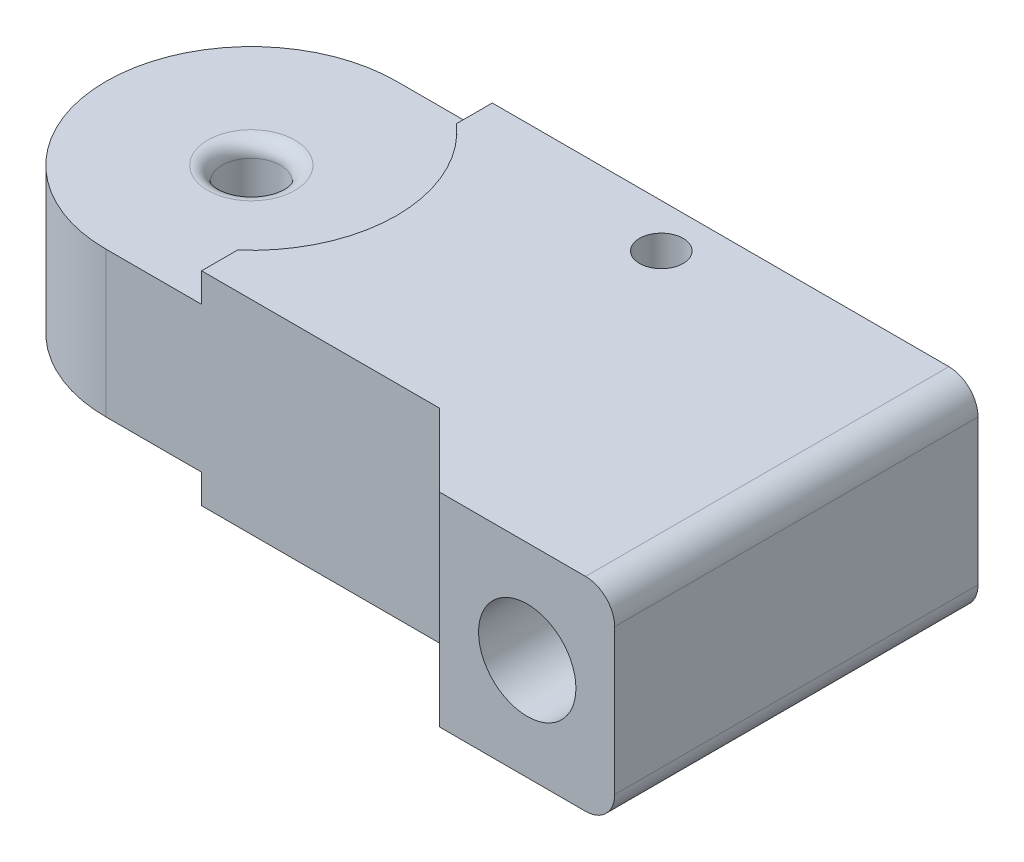
from build123d import *

# Parameters (mm, degrees)
SKETCH1_W           = 50
SKETCH1_H           = 20
BOSS_EXTRUDE1_DEPTH = 10
FILLET1_R           = 10
SKETCH2_R           = 2
CUT_EXTRUDE1_DEPTH  = 10
SKETCH4_R           = 3.35
CUT_EXTRUDE2_DEPTH  = 40
BOSS_EXTRUDE3_DEPTH = 2
SKETCH7_R           = 1.5
CUT_EXTRUDE3_DEPTH  = 20
FILLET3_R           = 2
FILLET4_R           = 1
SKETCH8_R           = 3.35
BOSS_EXTRUDE4_DEPTH = 5
CHAMFER1_SIZE       = 5


with BuildPart() as part:
    # Sketch1 → Boss-Extrude1 (new body)
    with BuildSketch(Plane(origin=(0, 0, 0), x_dir=(1, 0, 0), z_dir=(0, 1, 0))):
        Rectangle(SKETCH1_W, SKETCH1_H)
    extrude(amount=BOSS_EXTRUDE1_DEPTH)

    # Fillet1
    fillet1_edges = [part.edges().sort_by_distance(p)[0] for p in [
        (-25, 5, 10),
        (-25, 5, -10),
    ]]
    fillet(fillet1_edges, radius=FILLET1_R - 0.0001)  # a hair under: the kernel refuses the full size

    # Sketch2 → Cut-Extrude1 (cut)
    with BuildSketch(Plane(origin=(0, 10, 0), x_dir=(1, 0, 0), z_dir=(0, 1, 0))):
        with Locations(Location((-15, 0, 0), (0, 0, 270))):
            Circle(SKETCH2_R)
    extrude(amount=-CUT_EXTRUDE1_DEPTH, mode=Mode.SUBTRACT)

    # Sketch4 → Cut-Extrude2 (cut)
    with BuildSketch(Plane(origin=(0, 0, -10), x_dir=(-1, 0, 0), z_dir=(0, 0, -1))):
        with Locations((-18.984247751, 5)):
            Circle(SKETCH4_R)
    extrude(amount=-CUT_EXTRUDE2_DEPTH, mode=Mode.SUBTRACT)

    # Sketch6 → Boss-Extrude3 (add)
    with BuildSketch(Plane(origin=(0, 10, 0), x_dir=(1, 0, 0), z_dir=(0, 1, 0))):
        with BuildLine():
            Line((-8.420233762, 10), (-8.420233762, 7.53038354))
            ThreePointArc((-8.420233762, 7.53038354), (-5, 0), (-8.420233762, -7.53038354))
            Line((-8.420233762, -7.53038354), (-8.420233762, -10))
            Line((-8.420233762, -10), (25, -10))
            Line((25, -10), (25, 10))
            Line((25, 10), (-8.420233762, 10))
        make_face()
    boss_extrude3 = extrude(amount=BOSS_EXTRUDE3_DEPTH)

    # Sketch7 → Cut-Extrude3 (cut)
    with BuildSketch(Plane(origin=(0, 12, 0), x_dir=(1, 0, 0), z_dir=(0, 1, 0))):
        with Locations(Location((6.210160934, 7, 0), (0, 0, 270))):
            Circle(SKETCH7_R)
    cut_extrude3 = extrude(amount=-CUT_EXTRUDE3_DEPTH, mode=Mode.SUBTRACT)

    # Mirror3: Boss-Extrude3, Cut-Extrude3 across plane
    add(boss_extrude3.mirror(Plane(origin=(0, 5, 0), x_dir=(0, 0, 1), z_dir=(0, -1, 0))))
    add(cut_extrude3.mirror(Plane(origin=(0, 5, 0), x_dir=(0, 0, 1), z_dir=(0, -1, 0))), mode=Mode.SUBTRACT)

    # Fillet3
    fillet3_edges = [part.edges().sort_by_distance(p)[0] for p in [
        (25, 12, 0),
        (25, -2, 0),
    ]]
    fillet(fillet3_edges, radius=FILLET3_R)

    # Fillet4
    fillet4_edges = [part.edges().sort_by_distance(p)[0] for p in [
        (-15, 0, -2),
        (-15, 10, -2),
    ]]
    fillet(fillet4_edges, radius=FILLET4_R)

    # Sketch8 → Boss-Extrude4 (add)
    with BuildSketch(Plane.XY.offset(10)):
        with BuildLine():
            Line((12.964247751, 12), (12.964247751, -2))
            Line((12.964247751, -2), (23, -2))
            ThreePointArc((23, -2), (24.414213562, -1.414213562), (25, 0))
            Line((25, 0), (25, 10))
            ThreePointArc((25, 10), (24.414213562, 11.414213562), (23, 12))
            Line((23, 12), (12.964247751, 12))
        make_face()
        with Locations(Location((18.984247751, 5, 0), (0, 0, 180))):
            Circle(SKETCH8_R, mode=Mode.SUBTRACT)
    extrude(amount=BOSS_EXTRUDE4_DEPTH)

    # Chamfer1
    chamfer1_edges = [part.edges().sort_by_distance(p)[0] for p in [
        (12.964247751, 5, 10),
    ]]
    chamfer(chamfer1_edges, length=CHAMFER1_SIZE - 0.0001)  # a hair under: the kernel refuses the full size


solid = part.part
